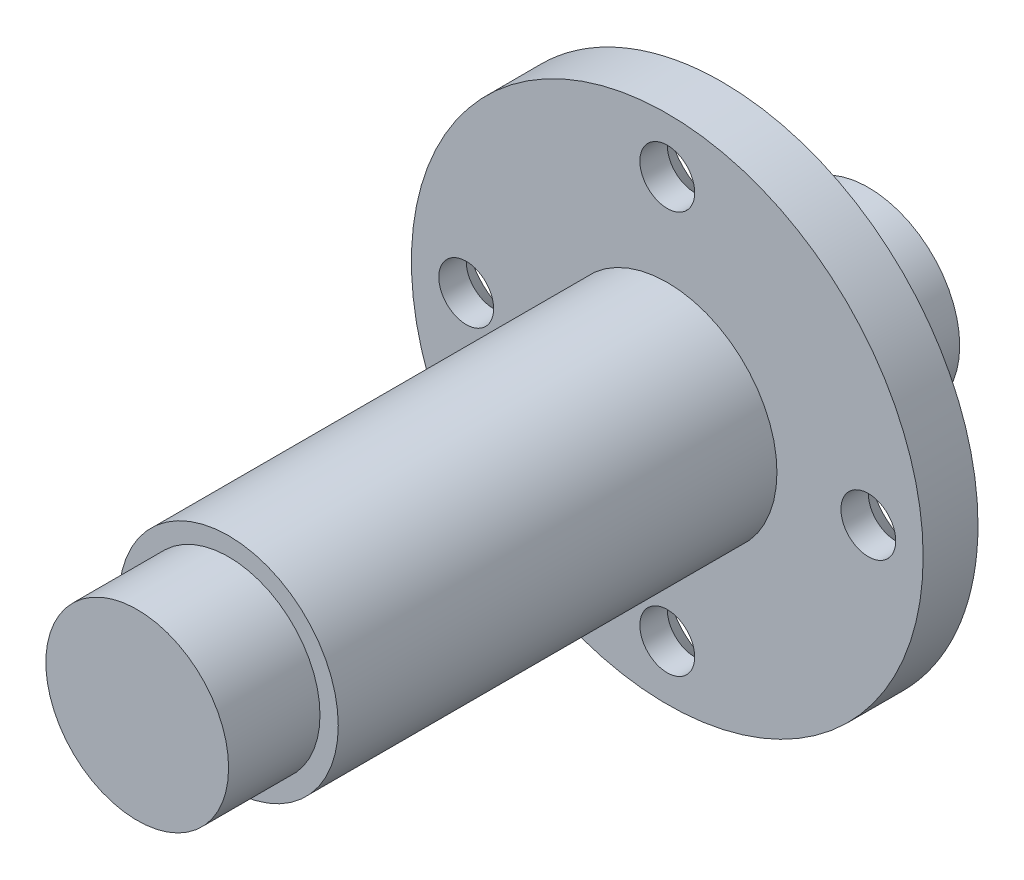
from build123d import *

# Parameters (mm, degrees)
CROQUIS1_R              = 5
SALIENTE_EXTRUIR1_DEPTH = 5
CROQUIS2_R              = 7
SALIENTE_EXTRUIR2_DEPTH = 3
CROQUIS3_R              = 14
SALIENTE_EXTRUIR3_DEPTH = 3
CROQUIS4_R              = 6
SALIENTE_EXTRUIR4_DEPTH = 24
CROQUIS5_R              = 5
SALIENTE_EXTRUIR5_DEPTH = 5
CROQUIS6_R              = 1.5
CORTAR_EXTRUIR1_DEPTH   = 5
CHAFL_N1_SIZE           = 1.5


with BuildPart() as part:
    # Croquis1 → Saliente-Extruir1 (new body)
    with BuildSketch(Plane.XY):
        Circle(CROQUIS1_R)
    extrude(amount=SALIENTE_EXTRUIR1_DEPTH)

    # Croquis2 → Saliente-Extruir2 (add)
    with BuildSketch(Plane.XY.offset(5)):
        Circle(CROQUIS2_R)
    extrude(amount=SALIENTE_EXTRUIR2_DEPTH)

    # Croquis3 → Saliente-Extruir3 (add)
    with BuildSketch(Plane.XY.offset(8)):
        Circle(CROQUIS3_R)
    extrude(amount=SALIENTE_EXTRUIR3_DEPTH)

    # Croquis4 → Saliente-Extruir4 (add)
    with BuildSketch(Plane.XY.offset(11)):
        Circle(CROQUIS4_R)
    extrude(amount=SALIENTE_EXTRUIR4_DEPTH)

    # Croquis5 → Saliente-Extruir5 (add)
    with BuildSketch(Plane.XY.offset(35)):
        Circle(CROQUIS5_R)
    extrude(amount=SALIENTE_EXTRUIR5_DEPTH)

    # Croquis6 → Cortar-Extruir1 (cut)
    with BuildSketch(Plane(origin=(0, 0, 8), x_dir=(-1, 0, 0), z_dir=(0, 0, -1))):
        with Locations((11, 0)):
            Circle(CROQUIS6_R)
        with Locations((0, -11)):
            Circle(CROQUIS6_R)
        with Locations((-11, 0)):
            Circle(CROQUIS6_R)
        with Locations((0, 11)):
            Circle(CROQUIS6_R)
    extrude(amount=-CORTAR_EXTRUIR1_DEPTH, mode=Mode.SUBTRACT)

    # Chaflán1
    chafl_n1_edges = [part.edges().sort_by_distance(p)[0] for p in [
        (-9.5, 0, 8),
        (1.5, -11, 8),
        (12.5, 0, 8),
        (1.5, 11, 8),
    ]]
    chamfer(chafl_n1_edges, length=CHAFL_N1_SIZE - 0.0001)  # a hair under: the kernel refuses the full size


solid = part.part
